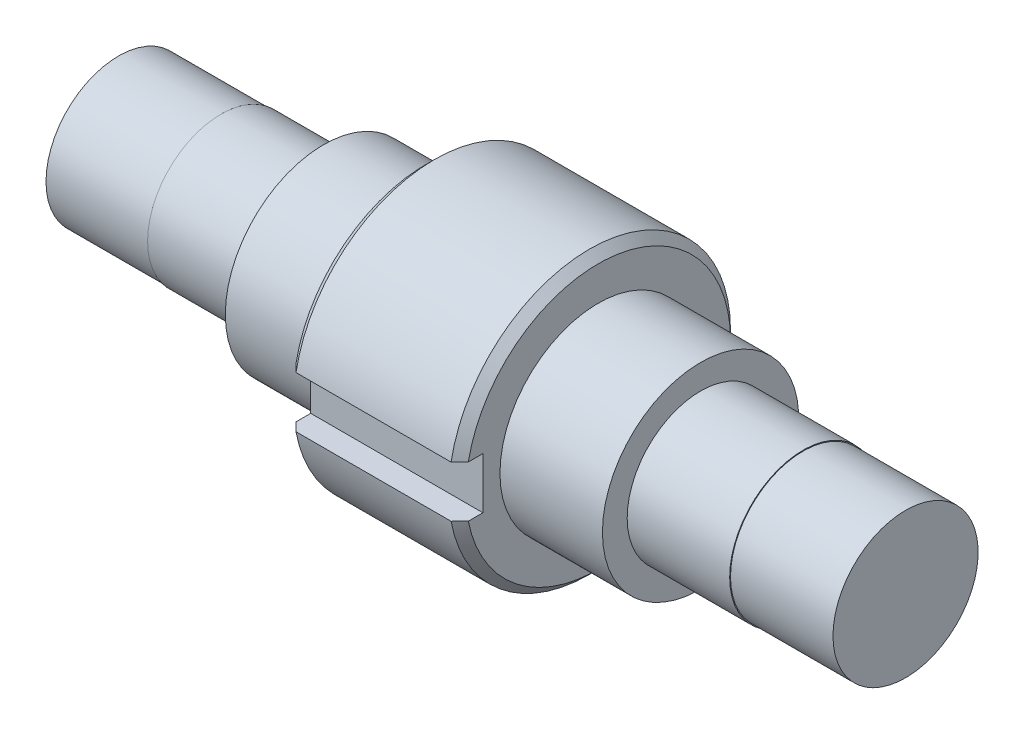
from build123d import *

# Parameters (mm, degrees)
CUT_EXTRUDE1_DEPTH = 61.817155526
CHAMFER1_SIZE      = 1


with BuildPart() as part:
    # Sketch1 → Revolve1 (revolve)
    with BuildSketch(Plane.XY):
        Polygon((-29.286076795, 16.5), (-49.448576795, 16.5), (-49.448576795, 11.5), (-61.448576795, 11.5), (-61.448576795, 8.6), (-73.448576795, 8.6), (-73.448576795, 8.5), (-85.448576795, 8.5), (-85.448576795, 0), (6.713923205, 0), (6.713923205, 8.5), (-5.286076795, 8.5), (-5.286076795, 8.6), (-17.286076795, 8.6), (-17.286076795, 11.5), (-29.286076795, 11.5), align=None)
    revolve(axis=Axis((-85.448576795, 0, 0), (1, 0, 0)))

    # Sketch3 → Cut-Extrude1 (cut, through all)
    with BuildSketch(Plane(origin=(-29.286076795, 0, 0), x_dir=(0, 0, -1), z_dir=(1, 0, 0))):
        with BuildLine():
            Line((-16.22498074, -3), (-13.5, -3))
            Line((-13.5, -3), (-13.5, 3))
            Line((-13.5, 3), (-16.22498074, 3))
            ThreePointArc((-16.22498074, 3), (-16.5, 0), (-16.22498074, -3))
        make_face()
    extrude(amount=-CUT_EXTRUDE1_DEPTH, mode=Mode.SUBTRACT)

    # Chamfer1
    chamfer1_edges = [part.edges().sort_by_distance(p)[0] for p in [
        (-49.448576795, 0, -16.5),
        (-29.286076795, 0, -16.5),
    ]]
    chamfer(chamfer1_edges, length=CHAMFER1_SIZE)


solid = part.part
